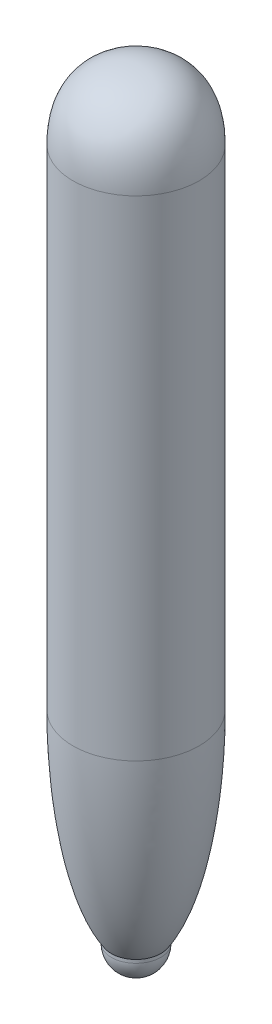
from build123d import *


# Read off the part's stored shape, not the designer's step: Revolve1
with BuildPart() as part:
    # Revolve1 outline → Revolve1 (revolve)
    with BuildSketch(Plane.XY):
        with BuildLine():
            add(Edge.make_bspline(
                [(0, 0), (139.549394705, 33.92634695), (203.2, 396.111416325), (203.2, 704.706637656)],
                knots=[0, 0, 0, 0, 1, 1, 1, 1], degree=3))
            Line((203.2, 704.706637656), (203.2, 2280.695627176))
            add(Edge.make_bspline(
                [(203.2, 2280.695627176), (203.2, 2426.173995889), (127.337237948, 2501.9), (0, 2501.9)],
                knots=[0, 0, 0, 0, 1, 1, 1, 1], degree=3))
            Line((0, 2501.9), (0, 0))
        make_face()
    revolve(axis=Axis((0, 0, 0), (0, 1, 0)))

    # Sketch2 → Revolve2 (revolve)
    with BuildSketch(Plane.XY, mode=Mode.PRIVATE) as revolve2_sk:
        with BuildLine():
            Line((79.764845599, 53.171943602), (79.764845599, 129.186428708))
            Line((79.764845599, 129.186428708), (0, 129.186428708))
            Line((0, 129.186428708), (0, -26.592901997))
            ThreePointArc((0, -26.592901997), (56.402263223, -3.230319621), (79.764845599, 53.171943602))
        make_face()
    revolve(revolve2_sk.sketch.rotate(Axis((0, 53.171943602, 0), (0, -1, 0)), 270), axis=Axis((0, 53.171943602, 0), (0, -1, 0)))


solid = part.part
